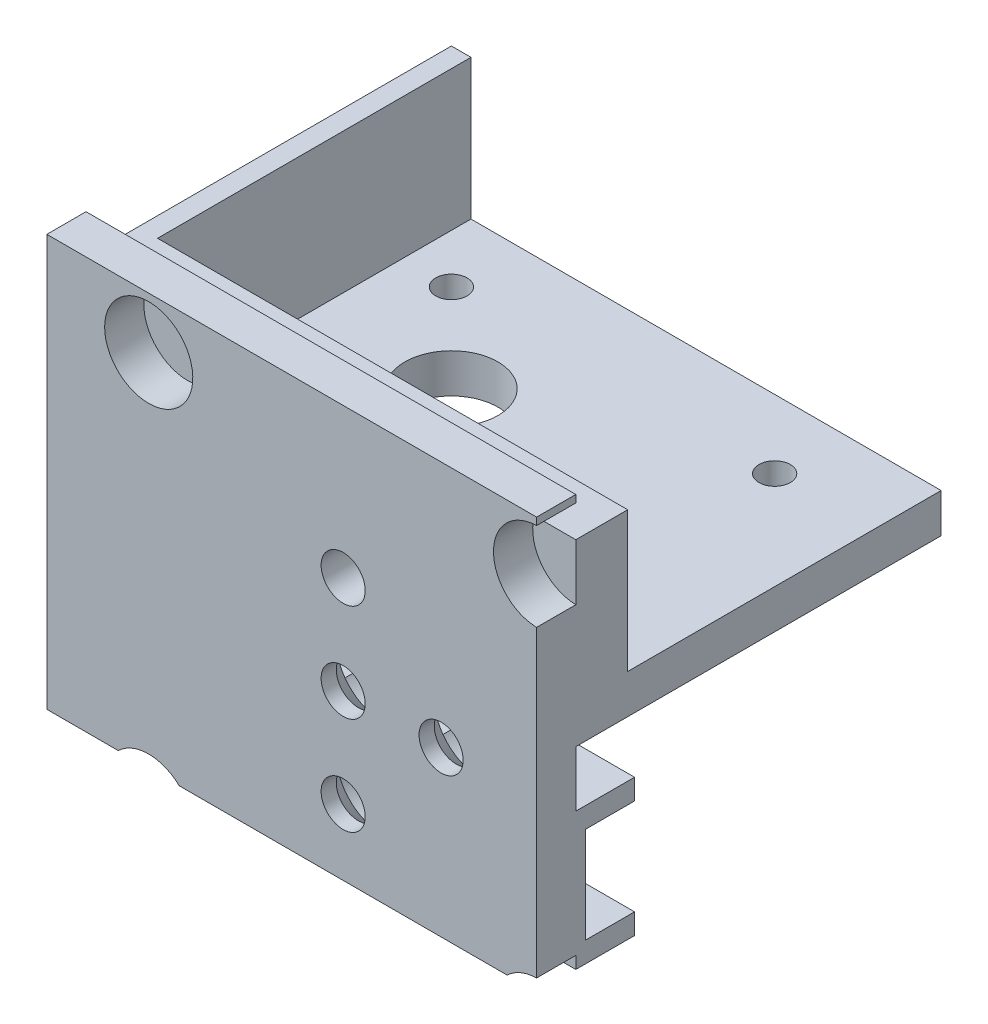
from build123d import *
from build123d.topology import SkipClean

# Parameters (mm, degrees)
BOSS_EXTRUDE1_START       = 0.5
SKETCH1_W                 = 25
SKETCH1_H                 = 14
BOSS_EXTRUDE1_DEPTH       = 2
SKETCH2_W                 = 25
SKETCH2_H                 = 2.1
BOSS_EXTRUDE2_DEPTH       = 6
SKETCH3_W                 = 50
SKETCH3_H                 = 42
BOSS_EXTRUDE3_DEPTH       = 4
BOSS_EXTRUDE5_START       = -18.3
SKETCH4_2_R               = 1.5
BOSS_EXTRUDE5_DEPTH       = 4
SKETCH5_W                 = 50
SKETCH5_H                 = 18.3
BOSS_EXTRUDE6_DEPTH       = 5.3
SKETCH7_R                 = 4.5
CUT_EXTRUDE1_DEPTH        = 4
SKETCH9_W                 = 35.343646405
SKETCH9_H                 = 8.813303651
CUT_EXTRUDE3_DEPTH        = 10
SKETCH11_R                = 12.5
SKETCH11_R_2              = 1.5
SKETCH11_R_3              = 3.55
BOSS_EXTRUDE7_DEPTH       = 4
SKETCH12_R                = 12.5
BOSS_EXTRUDE8_DEPTH       = 14
SKETCH13_W                = 25
SKETCH13_H                = 2.1
BOSS_EXTRUDE9_DEPTH       = 6
CUT_EXTRUDE2_DEPTH        = 64.84830294
SKETCH14_W                = 9.591087042
SKETCH14_H                = 22.957747356
CUT_EXTRUDE4_DEPTH        = 64.347816028
SKETCH15_W                = 33.975925545
SKETCH15_H                = 18.244219276
CUT_EXTRUDE5_DEPTH        = 62.391693358
SKETCH16_W                = 32
SKETCH16_H                = 4
BOSS_EXTRUDE10_DEPTH      = 50
SKETCH18_W                = 2
SKETCH18_H                = 14.3
BOSS_EXTRUDE11_DEPTH      = 32
CUT_EXTRUDE6_DEPTH        = 58.135766279
F_1_0MM_DOWEL_HOLE1_D     = 3.2
F_1_0MM_DOWEL_HOLE1_DEPTH = 33.03862301
F_1_0MM_DOWEL_HOLE1_TIP   = 0.96137699
BOSS_EXTRUDE12_DEPTH      = 1
CUT_EXTRUDE7_DEPTH        = 10
CHAMFER1_SIZE             = 2


# Read off the part's stored shape, not the designer's step: CSK for M4 Flat Head Machine Screw1
with BuildPart() as part:
    # Sketch1 → Boss-Extrude1 (new body)
    with BuildSketch(Plane.XY.offset(-1).offset(BOSS_EXTRUDE1_START)):
        with Locations((23.192657344, 4)):
            Rectangle(SKETCH1_W, SKETCH1_H)
    extrude(amount=BOSS_EXTRUDE1_DEPTH)

    # Sketch2 → Boss-Extrude2 (add)
    with BuildSketch(Plane(origin=(0, 0, -0.5), x_dir=(-1, 0, 0), z_dir=(0, 0, -1))):
        with Locations((-23.192657344, 9.95)):
            Rectangle(SKETCH2_W, SKETCH2_H)
        with Locations((-23.192657344, -1.95)):
            Rectangle(SKETCH2_W, SKETCH2_H)
    extrude(amount=BOSS_EXTRUDE2_DEPTH)

    # Sketch3 → Boss-Extrude3 (add)
    with BuildSketch(Plane(origin=(0, 0, -0.5), x_dir=(-1, 0, 0), z_dir=(0, 0, -1))):
        with Locations((-10.692657344, 18)):
            Rectangle(SKETCH3_W, SKETCH3_H)
    extrude(amount=-BOSS_EXTRUDE3_DEPTH)

    # Sketch4<2> → Boss-Extrude5 (add)
    with BuildSketch(Plane(origin=(0, 35, 0), x_dir=(1, 0, 0), z_dir=(0, 1, 0)).offset(BOSS_EXTRUDE5_START)):
        with BuildLine():
            Line((-1.349302764, 24.5), (-1.349302764, 0.5))
            Line((-1.349302764, 0.5), (8.650697236, 0.5))
            Line((8.650697236, 0.5), (8.650697236, 24.5))
            ThreePointArc((8.650697236, 24.5), (3.650697236, 29.5), (-1.349302764, 24.5))
        make_face()
        with Locations(Location((3.650697236, 7.5, 0), (0, 0, 270))):
            Circle(SKETCH4_2_R, mode=Mode.SUBTRACT)
        with Locations(Location((3.650697236, 24.5, 0), (0, 0, 270))):
            Circle(SKETCH4_2_R, mode=Mode.SUBTRACT)
    extrude(amount=-BOSS_EXTRUDE5_DEPTH)

    # Sketch5 → Boss-Extrude6 (add)
    with BuildSketch(Plane(origin=(0, 0, -0.5), x_dir=(-1, 0, 0), z_dir=(0, 0, -1))):
        with Locations((-10.692657344, 25.85)):
            Rectangle(SKETCH5_W, SKETCH5_H)
    extrude(amount=BOSS_EXTRUDE6_DEPTH)

    # CSK for M4 Flat Head Machine Screw1 outl → CSK for M4 Flat Head Machine Screw1 (revolve, cut)
    with BuildSketch(Plane(origin=(15.942657344, 23.75, 0), x_dir=(1, 0, 0), z_dir=(0, -1, 0))):
        Polygon((2.25, -3.35), (2.25, 3.5), (0, 3.5), (0, -5.8), (4.7, -5.8), align=None)
    revolve(axis=Axis((15.942657344, 23.75, 0), (0, 0, 1)), mode=Mode.SUBTRACT)

    # CSK for M4 Flat Head Machine Screw1 2 ou → CSK for M4 Flat Head Machine Screw1 2 (revolve, cut)
    with BuildSketch(Plane(origin=(15.942657344, 3.75, 0), x_dir=(1, 0, 0), z_dir=(0, -1, 0))):
        Polygon((4.7, -0.5), (2.25, 1.95), (2.25, 3.5), (0, 3.5), (0, -0.5), align=None)
    revolve(axis=Axis((15.942657344, 3.75, 0), (0, 0, 1)), mode=Mode.SUBTRACT)

    # CSK for M4 Flat Head Machine Screw1 3 ou → CSK for M4 Flat Head Machine Screw1 3 (revolve, cut)
    with BuildSketch(Plane(origin=(15.942657344, 13.75, 0), x_dir=(1, 0, 0), z_dir=(0, -1, 0))):
        Polygon((4.7, -0.5), (2.25, 1.95), (2.25, 3.5), (0, 3.5), (0, -0.5), align=None)
    revolve(axis=Axis((15.942657344, 13.75, 0), (0, 0, 1)), mode=Mode.SUBTRACT)

    # CSK for M4 Flat Head Machine Screw1 4 ou → CSK for M4 Flat Head Machine Screw1 4 (revolve, cut)
    with BuildSketch(Plane(origin=(25.942657344, 13.75, 0), x_dir=(1, 0, 0), z_dir=(0, -1, 0))):
        Polygon((2.25, 1.95), (2.25, 3.5), (0, 3.5), (0, -0.5), (4.7, -0.5), align=None)
    revolve(axis=Axis((25.942657344, 13.75, 0), (0, 0, 1)), mode=Mode.SUBTRACT)

    # Sketch7 → Cut-Extrude1 (cut)
    with BuildSketch(Plane(origin=(0, 0, 3.5), x_dir=(-1, 0, 0), z_dir=(0, 0, -1))):
        with Locations((-35.792657344, 33.75)):
            Circle(SKETCH7_R)
        with Locations(Location((3.907342656, 33.75, 0), (0, 0, 163.872379787))):
            Circle(SKETCH7_R)
        with Locations((3.907342656, -6.25)):
            Circle(SKETCH7_R)
        with Locations((-35.792657344, -6.25)):
            Circle(SKETCH7_R)
    extrude(amount=CUT_EXTRUDE1_DEPTH, mode=Mode.SUBTRACT)

    # Sketch9 → Cut-Extrude3 (cut)
    with BuildSketch(Plane.ZY.offset(1.349302764)):
        with Locations((-18.171823203, 12.293348175)):
            Rectangle(SKETCH9_W, SKETCH9_H)
    extrude(amount=-CUT_EXTRUDE3_DEPTH, mode=Mode.SUBTRACT)

    # Sketch11 → Boss-Extrude7 (add)
    # profile 1 of 4: a face of its own
    with BuildSketch(Plane.XZ.offset(-16.7)):
        with BuildLine():
            Line((-3.212467494, -5.8), (-14.307342656, -5.8))
            Line((-14.307342656, -5.8), (-14.807342656, -5.8))
            Line((-14.807342656, -5.8), (-14.807342656, -20.8))
            ThreePointArc((-14.807342656, -20.8), (-11.570691199, -11.320533638), (-3.212467494, -5.8))
        make_face()
    # profile 2 of 4: a face of its own
    with BuildSketch(Plane.XZ.offset(-16.7)):
        with BuildLine():
            Line((4.597782182, -5.8), (-3.212467494, -5.8))
            ThreePointArc((-3.212467494, -5.8), (-11.570691199, -11.320533638), (-14.807342656, -20.8))
            ThreePointArc((-14.807342656, -20.8), (0.692657344, -36.3), (16.192657344, -20.8))
            ThreePointArc((16.192657344, -20.8), (12.956005887, -11.320533638), (4.597782182, -5.8))
        make_face()
        with Locations((0.692657344, -20.8)):
            Circle(SKETCH11_R, mode=Mode.SUBTRACT)
    # profile 3 of 4: a face of its own
    with BuildSketch(Plane.XZ.offset(-16.7)):
        with Locations((0.692657344, -20.8)):
            Circle(SKETCH11_R)
        with Locations(Location((0.692657344, -12.3, 0), (0, 0, 270))):
            Circle(SKETCH11_R_2, mode=Mode.SUBTRACT)
        with Locations(Location((0.692657344, -20.8, 0), (0, 0, 270))):
            Circle(SKETCH11_R_3, mode=Mode.SUBTRACT)
        with Locations(Location((9.192657344, -20.8, 0), (0, 0, 270))):
            Circle(SKETCH11_R_2, mode=Mode.SUBTRACT)
        with Locations(Location((0.692657344, -29.3, 0), (0, 0, 270))):
            Circle(SKETCH11_R_2, mode=Mode.SUBTRACT)
        with Locations(Location((-7.807342656, -20.8, 0), (0, 0, 270))):
            Circle(SKETCH11_R_2, mode=Mode.SUBTRACT)
    # profile 4 of 4: a face of its own
    with BuildSketch(Plane.XZ.offset(-16.7)):
        with BuildLine():
            Line((16.192657344, -5.8), (4.597782182, -5.8))
            ThreePointArc((4.597782182, -5.8), (12.956005887, -11.320533638), (16.192657344, -20.8))
            Line((16.192657344, -20.8), (16.192657344, -5.8))
        make_face()
    extrude(amount=-BOSS_EXTRUDE7_DEPTH)

    # Sketch12 → Boss-Extrude8 (add)
    with SkipClean():  # the faces are left unmerged after this step: merging them gives an invalid solid
        with BuildSketch(Plane(origin=(0, 20.7, 0), x_dir=(1, 0, 0), z_dir=(0, 1, 0))):
            with BuildLine():
                Line((-14.807342656, 20.8), (-14.807342656, 5.8))
                Line((-14.807342656, 5.8), (16.192657344, 5.8))
                Line((16.192657344, 5.8), (16.192657344, 20.8))
                ThreePointArc((16.192657344, 20.8), (0.692657344, 36.3), (-14.807342656, 20.8))
            make_face()
            with Locations(Location((0.692657344, 20.8, 0), (0, 0, 270))):
                Circle(SKETCH12_R, mode=Mode.SUBTRACT)
        extrude(amount=BOSS_EXTRUDE8_DEPTH)

    # Sketch13 → Boss-Extrude9 (add)
    with SkipClean():  # the faces are left unmerged after this step: merging them gives an invalid solid
        with BuildSketch(Plane(origin=(0, 0, -0.5), x_dir=(-1, 0, 0), z_dir=(0, 0, -1))):
            with Locations((1.807342656, 9.95)):
                Rectangle(SKETCH13_W, SKETCH13_H)
            with Locations((1.807342656, -1.95)):
                Rectangle(SKETCH13_W, SKETCH13_H)
        extrude(amount=BOSS_EXTRUDE9_DEPTH)

    # Sketch8 → Cut-Extrude2 (cut, through all)
    with SkipClean():  # the faces are left unmerged after this step: merging them gives an invalid solid
        with BuildSketch(Plane(origin=(0, 0, -0.5), x_dir=(-1, 0, 0), z_dir=(0, 0, -1))):
            with BuildLine():
                ThreePointArc((-12.283764069, 16.7), (-15.942657344, 18.45), (-19.601550619, 16.7))
                ThreePointArc((-19.601550619, 16.7), (-20.640973864, 13.875785056), (-19.754153113, 11))
                ThreePointArc((-19.754153113, 11), (-15.942657344, 9.05), (-12.131161575, 11))
                ThreePointArc((-12.131161575, 11), (-11.244340824, 13.875785056), (-12.283764069, 16.7))
            make_face()
            with BuildLine():
                ThreePointArc((-22.283764069, 16.7), (-25.942657344, 18.45), (-29.601550619, 16.7))
                ThreePointArc((-29.601550619, 16.7), (-30.640973864, 13.875785056), (-29.754153113, 11))
                ThreePointArc((-29.754153113, 11), (-25.942657344, 9.05), (-22.131161575, 11))
                ThreePointArc((-22.131161575, 11), (-21.244340824, 13.875785056), (-22.283764069, 16.7))
            make_face()
        extrude(amount=CUT_EXTRUDE2_DEPTH, mode=Mode.SUBTRACT)

    # Sketch14 → Cut-Extrude4 (cut, through all)
    with SkipClean():  # the faces are left unmerged after this step: merging them gives an invalid solid
        with BuildSketch(Plane(origin=(0, 34.7, 0), x_dir=(1, 0, 0), z_dir=(0, 1, 0))):
            with Locations((-19.102886177, 17.278873678)):
                Rectangle(SKETCH14_W, SKETCH14_H)
        extrude(amount=-CUT_EXTRUDE4_DEPTH, mode=Mode.SUBTRACT)

    # Sketch15 → Cut-Extrude5 (cut, through all)
    with BuildSketch(Plane(origin=(16.192657344, 0, 0), x_dir=(0, 0, -1), z_dir=(1, 0, 0))):
        with Locations((22.787962773, 25.822109638)):
            Rectangle(SKETCH15_W, SKETCH15_H)
    extrude(amount=-CUT_EXTRUDE5_DEPTH, mode=Mode.SUBTRACT)

    # Sketch16 → Boss-Extrude10 (add, through all)
    with BuildSketch(Plane.ZY.offset(14.307342656)):
        with Locations((-21.8, 18.7)):
            Rectangle(SKETCH16_W, SKETCH16_H)
    extrude(amount=-BOSS_EXTRUDE10_DEPTH)

    # Sketch18 → Boss-Extrude11 (add, through all)
    with BuildSketch(Plane(origin=(0, 0, -5.8), x_dir=(-1, 0, 0), z_dir=(0, 0, -1))):
        with Locations((13.307342656, 27.85)):
            Rectangle(SKETCH18_W, SKETCH18_H)
    extrude(amount=BOSS_EXTRUDE11_DEPTH)

    # Sketch19 → Cut-Extrude6 (cut, through all)
    with BuildSketch(Plane(origin=(0, 20.7, 0), x_dir=(1, 0, 0), z_dir=(0, 1, 0))):
        with BuildLine():
            ThreePointArc((3.376188065, 17.358353423), (6.134303921, 23.483530721), (0.009126623, 26.241646577))
            ThreePointArc((0.009126623, 26.241646577), (-2.748989233, 20.116469279), (3.376188065, 17.358353423))
        make_face()
    extrude(amount=-CUT_EXTRUDE6_DEPTH, mode=Mode.SUBTRACT)

    # Ø1.0mm Dowel Hole1
    with Locations(Plane(origin=(-7.307342656, 20.7, -30.8), x_dir=(0, 0, 1), z_dir=(0, 1, 0))):
        with Locations((0, 0), (18, 0), (18, 33), (0, 33)):
            Hole(F_1_0MM_DOWEL_HOLE1_D / 2, depth=F_1_0MM_DOWEL_HOLE1_DEPTH)
            with Locations((0, 0, -(F_1_0MM_DOWEL_HOLE1_DEPTH + F_1_0MM_DOWEL_HOLE1_TIP / 2))):  # 118° drill point
                Cone(0, F_1_0MM_DOWEL_HOLE1_D / 2, F_1_0MM_DOWEL_HOLE1_TIP, mode=Mode.SUBTRACT)

    # Sketch21 → Boss-Extrude12 (add)
    with BuildSketch(Plane(origin=(0, 0, -0.5), x_dir=(-1, 0, 0), z_dir=(0, 0, -1))):
        with BuildLine():
            Line((-15.258917627, -0.9), (14.307342656, -0.9))
            Line((14.307342656, -0.9), (14.307342656, 8.9))
            Line((14.307342656, 8.9), (-35.692657344, 8.9))
            Line((-35.692657344, 8.9), (-35.692657344, -0.9))
            Line((-35.692657344, -0.9), (-16.626397061, -0.9))
            ThreePointArc((-16.626397061, -0.9), (-15.942657344, 8.45), (-15.258917627, -0.9))
        make_face()
    extrude(amount=BOSS_EXTRUDE12_DEPTH)

    # Sketch22 → Cut-Extrude7 (cut)
    with BuildSketch(Plane(origin=(0, 0, -5.8), x_dir=(-1, 0, 0), z_dir=(0, 0, -1))):
        with BuildLine():
            ThreePointArc((-22.283764069, 16.7), (-25.942657344, 18.45), (-29.601550619, 16.7))
            ThreePointArc((-29.601550619, 16.7), (-30.640973864, 13.875785056), (-29.754153113, 11))
            ThreePointArc((-29.754153113, 11), (-25.942657344, 9.05), (-22.131161575, 11))
            ThreePointArc((-22.131161575, 11), (-21.244340824, 13.875785056), (-22.283764069, 16.7))
        make_face()
        with BuildLine():
            ThreePointArc((-12.283764069, 16.7), (-15.942657344, 18.45), (-19.601550619, 16.7))
            ThreePointArc((-19.601550619, 16.7), (-20.640973864, 13.875785056), (-19.754153113, 11))
            ThreePointArc((-19.754153113, 11), (-15.942657344, 9.05), (-12.131161575, 11))
            ThreePointArc((-12.131161575, 11), (-11.244340824, 13.875785056), (-12.283764069, 16.7))
        make_face()
        with BuildLine():
            ThreePointArc((-19.518618753, 20.7), (-15.942657344, 19.05), (-12.366695935, 20.7))
            ThreePointArc((-12.366695935, 20.7), (-15.942657344, 28.45), (-19.518618753, 20.7))
        make_face()
    extrude(amount=CUT_EXTRUDE7_DEPTH, mode=Mode.SUBTRACT)

    # Chamfer1
    # the kernel refuses this chamfer: 2 mm, written as the material it takes off along each edge
    with BuildSketch(Plane(origin=(7.223329959, 20.7, -15.8), x_dir=(0, -0.9996219169112968, 0.02749587661058651), z_dir=(1, 0, 0))) as chamfer1_piece_1_section:
        Polygon((CHAMFER1_SIZE * 0.999621916911, CHAMFER1_SIZE * 0.0274958766106), (-CHAMFER1_SIZE * 0.0274958766106, CHAMFER1_SIZE * 0.999621916911), (0, 0), align=None)
    chamfer1_piece_1 = extrude(amount=17.43865477, mode=Mode.PRIVATE)
    chamfer1_piece_1 = chamfer1_piece_1 & Plane(origin=(15.942657344, 23.75, -16.543684423), x_dir=(0.7608428530186694, -0.6489361702127657, 0), z_dir=(0, 0, 1)) * Cylinder(4.7, 43, mode=Mode.PRIVATE)
    add(chamfer1_piece_1, mode=Mode.SUBTRACT)
    with BuildSketch(Plane(origin=(24.744916595, 16.7, -15.8), x_dir=(0, 0.9996219169112968, 0.02749587661058651), z_dir=(-1, 0, 0))) as chamfer1_piece_2_section:
        Polygon((CHAMFER1_SIZE * 0.999621916911, CHAMFER1_SIZE * 0.0274958766106), (-CHAMFER1_SIZE * 0.0274958766106, CHAMFER1_SIZE * 0.999621916911), (0, 0), align=None)
    chamfer1_piece_2 = extrude(amount=17.604518502, mode=Mode.PRIVATE)
    chamfer1_piece_2 = chamfer1_piece_2 & Plane(origin=(25.942657344, 13.75, -16.56864212), x_dir=(-0.8109565466765494, -0.5851063829787245, 0), z_dir=(0, 0, 1)) * Cylinder(4.7, 44, mode=Mode.PRIVATE)
    add(chamfer1_piece_2, mode=Mode.SUBTRACT)
    with BuildSketch(Plane(origin=(24.744916595, 16.7, -15.8), x_dir=(0, 0.9996219169112968, 0.02749587661058651), z_dir=(-1, 0, 0))) as chamfer1_piece_3_section:
        Polygon((CHAMFER1_SIZE * 0.999621916911, CHAMFER1_SIZE * 0.0274958766106), (-CHAMFER1_SIZE * 0.0274958766106, CHAMFER1_SIZE * 0.999621916911), (0, 0), align=None)
    chamfer1_piece_3 = extrude(amount=17.604518502, mode=Mode.PRIVATE)
    chamfer1_piece_3 = chamfer1_piece_3 & Plane(origin=(15.942657344, 13.75, -16.53312589), x_dir=(-0.7784879309138604, 0.6276595744680842, 0), z_dir=(0, 0, 1)) * Cylinder(4.7, 44, mode=Mode.PRIVATE)
    add(chamfer1_piece_3, mode=Mode.SUBTRACT)
    with BuildSketch(Plane(origin=(34.744916595, 16.7, -15.8), x_dir=(0, 0.9996219169112968, 0.02749587661058651), z_dir=(-1, 0, 0))) as chamfer1_piece_4_section:
        Polygon((CHAMFER1_SIZE * 0.999621916911, CHAMFER1_SIZE * 0.0274958766106), (-CHAMFER1_SIZE * 0.0274958766106, CHAMFER1_SIZE * 0.999621916911), (0, 0), align=None)
    chamfer1_piece_4 = extrude(amount=17.604518502, mode=Mode.PRIVATE)
    chamfer1_piece_4 = chamfer1_piece_4 & Plane(origin=(25.942657344, 13.75, -16.533125893), x_dir=(-0.8109565466765494, -0.5851063829787245, 0), z_dir=(0, 0, 1)) * Cylinder(4.7, 44, mode=Mode.PRIVATE)
    add(chamfer1_piece_4, mode=Mode.SUBTRACT)
    with BuildSketch(Plane(origin=(34.744916595, 16.7, -15.8), x_dir=(0, 0.9996219169112968, 0.02749587661058651), z_dir=(-1, 0, 0))) as chamfer1_piece_5_section:
        Polygon((CHAMFER1_SIZE * 0.999621916911, CHAMFER1_SIZE * 0.0274958766106), (-CHAMFER1_SIZE * 0.0274958766106, CHAMFER1_SIZE * 0.999621916911), (0, 0), align=None)
    chamfer1_piece_5 = extrude(amount=17.604518502, mode=Mode.PRIVATE)
    chamfer1_piece_5 = chamfer1_piece_5 & Plane(origin=(15.942657344, 13.75, -16.568642119), x_dir=(-0.7784879309138604, 0.6276595744680842, 0), z_dir=(0, 0, 1)) * Cylinder(4.7, 44, mode=Mode.PRIVATE)
    add(chamfer1_piece_5, mode=Mode.SUBTRACT)


solid = part.part
